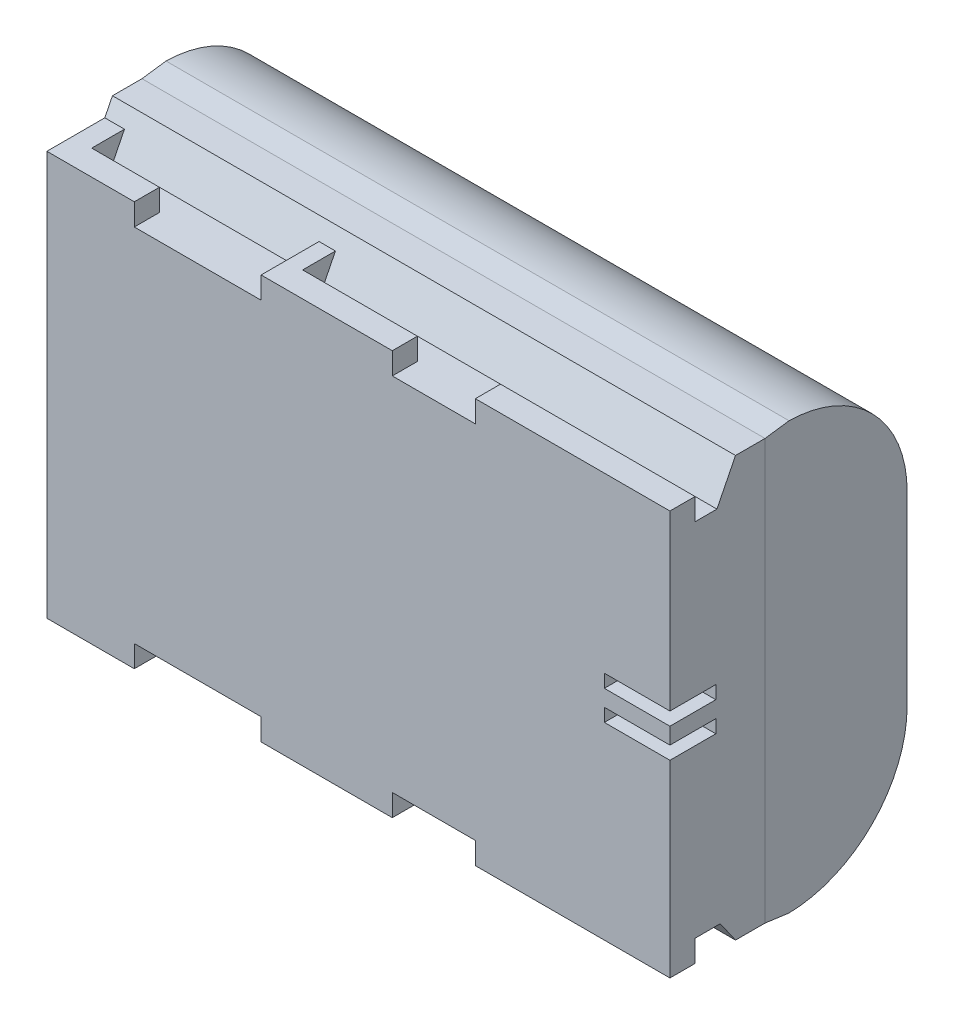
from build123d import *

# Parameters (mm, degrees)
SKETCH_1_W          = 57
SKETCH_1_H          = 38.4
EXTRUDE_1_DEPTH     = 8.7
SKETCH_2_W          = 57
SKETCH_2_H          = 1.4
CUT_EXTRUDE_1_DEPTH = 2.3
SKETCH_3_W          = 57
SKETCH_3_H          = 2.3
CUT_EXTRUDE_2_DEPTH = 2
SKETCH_4_W          = 11.6
SKETCH_4_H          = 2
SKETCH_4_W_2        = 7.6
CUT_EXTRUDE_3_DEPTH = 2.3
CUT_EXTRUDE_4_DEPTH = 70.276619433
SKETCH_6_W          = 1.5
SKETCH_6_H          = 3.7
SKETCH_6_W_2        = 1.8
EXTRUDE_2_DEPTH     = 2
SKETCH_7_W          = 1.8
SKETCH_7_H          = 3.7
SKETCH_7_W_2        = 1.5
EXTRUDE_3_DEPTH     = 2
SKETCH_10_W         = 6
SKETCH_10_H         = 1.2
CUT_EXTRUDE_5_DEPTH = 4.2
EXTRUDE_4_DEPTH     = 57
FILLET_1_R          = 11


with BuildPart() as part:
    # Эскиз1 → Бобышка-Вытянуть1 (new body)
    with BuildSketch(Plane.XY):
        with Locations((28.5, 19.2)):
            Rectangle(SKETCH_1_W, SKETCH_1_H)
    extrude(amount=EXTRUDE_1_DEPTH)

    # Эскиз2 → Вырез-Вытянуть1 (cut)
    with BuildSketch(Plane.XY.offset(8.7)):
        with Locations((28.5, 37.7)):
            Rectangle(SKETCH_2_W, SKETCH_2_H)
    extrude(amount=-CUT_EXTRUDE_1_DEPTH, mode=Mode.SUBTRACT)

    # Эскиз3 → Вырез-Вытянуть2 (cut)
    with BuildSketch(Plane(origin=(0, 0, 0), x_dir=(1, 0, 0), z_dir=(0, 1, 0))):
        with Locations((28.5, -5.25)):
            Rectangle(SKETCH_3_W, SKETCH_3_H)
    extrude(amount=CUT_EXTRUDE_2_DEPTH, mode=Mode.SUBTRACT)

    # Эскиз4 → Вырез-Вытянуть3 (cut)
    with BuildSketch(Plane.XY.offset(8.7)):
        with Locations((13.8, 1)):
            Rectangle(SKETCH_4_W, SKETCH_4_H)
        with Locations((35.4, 1)):
            Rectangle(SKETCH_4_W_2, SKETCH_4_H)
        with Locations((35.4, 36)):
            Rectangle(SKETCH_4_W_2, SKETCH_4_H)
        with Locations((13.8, 36)):
            Rectangle(SKETCH_4_W, SKETCH_4_H)
    extrude(amount=-CUT_EXTRUDE_3_DEPTH, mode=Mode.SUBTRACT)

    # Эскиз5 → Вырез-Вытянуть4 (cut, through all)
    with BuildSketch(Plane(origin=(57, 0, 0), x_dir=(0, 0, -1), z_dir=(1, 0, 0))):
        Polygon((-4.1, 0), (-4.1, 2), (-2.7, 0), align=None)
        Polygon((-4.4, 35), (-2.7, 38.4), (-6.4, 38.4), (-6.4, 37), (-6.4, 35), align=None)
    extrude(amount=-CUT_EXTRUDE_4_DEPTH, mode=Mode.SUBTRACT)

    # Эскиз6 → Бобышка-Вытянуть2 (add)
    with BuildSketch(Plane.XZ):
        with Locations((20.35, 4.55)):
            Rectangle(SKETCH_6_W, SKETCH_6_H)
        with Locations((0.9, 4.55)):
            Rectangle(SKETCH_6_W_2, SKETCH_6_H)
    extrude(amount=-EXTRUDE_2_DEPTH)

    # Эскиз7 → Бобышка-Вытянуть3 (add)
    with BuildSketch(Plane(origin=(0, 37, 0), x_dir=(1, 0, 0), z_dir=(0, 1, 0))):
        with Locations((0.9, -4.55)):
            Rectangle(SKETCH_7_W, SKETCH_7_H)
        with Locations((20.35, -4.55)):
            Rectangle(SKETCH_7_W_2, SKETCH_7_H)
    extrude(amount=-EXTRUDE_3_DEPTH)

    # Эскиз10 → Вырез-Вытянуть5 (cut)
    with BuildSketch(Plane.XY.offset(8.7)):
        with Locations((54, 20.55)):
            Rectangle(SKETCH_10_W, SKETCH_10_H)
        with Locations((54, 17.85)):
            Rectangle(SKETCH_10_W, SKETCH_10_H)
    extrude(amount=-CUT_EXTRUDE_5_DEPTH, mode=Mode.SUBTRACT)


with BuildPart() as body_2:
    # Эскиз11 → Бобышка-Вытянуть4 (new body)
    with BuildSketch(Plane.ZY):
        Polygon((0, 0), (-2.2, -0.3), (-13, -0.3), (-13, 38.7), (-2.2, 38.7), (0, 38.4), align=None)
    extrude(amount=-EXTRUDE_4_DEPTH)

    # Скругление1
    # the kernel refuses this fillet: 11 mm, written as the material it takes off along each edge
    with BuildSketch(Plane(origin=(-27.49545417, 38.7, -13), x_dir=(0, -1, 0), z_dir=(1, 0, 0))) as fillet_1_piece_1:
        with BuildLine():
            CenterArc((10.998181668, -11), FILLET_1_R, 90, 88.95820115)
            Line((0, -10.8), (-0.219963633, -10.796))
            ThreePointArc((-0.219963633, -10.796), (-0.22, -5.4), (-0.22, 0))
            Line((-0.22, 0), (0, 0.22))
            Line((0, 0.22), (10.998181668, 0.22))
            Line((10.998181668, 0.22), (10.998181668, 0))
        make_face()
    extrude(amount=111.990908339, mode=Mode.SUBTRACT)
    with BuildSketch(Plane(origin=(-27.49545417, -0.3, -13), x_dir=(0, 0, 1), z_dir=(1, 0, 0))) as fillet_1_piece_2:
        with BuildLine():
            CenterArc((11, -10.998181668), FILLET_1_R, 91.04179885, 88.95820115)
            Line((0, -10.998181668), (-0.22, -10.998181668))
            Line((-0.22, -10.998181668), (-0.22, 0))
            Line((-0.22, 0), (0, 0.22))
            ThreePointArc((0, 0.22), (5.4, 0.22), (10.796, 0.219963633))
            Line((10.796, 0.219963633), (10.8, 0))
        make_face()
    extrude(amount=111.990908339, mode=Mode.SUBTRACT)


solid = Compound([part.part, body_2.part])
